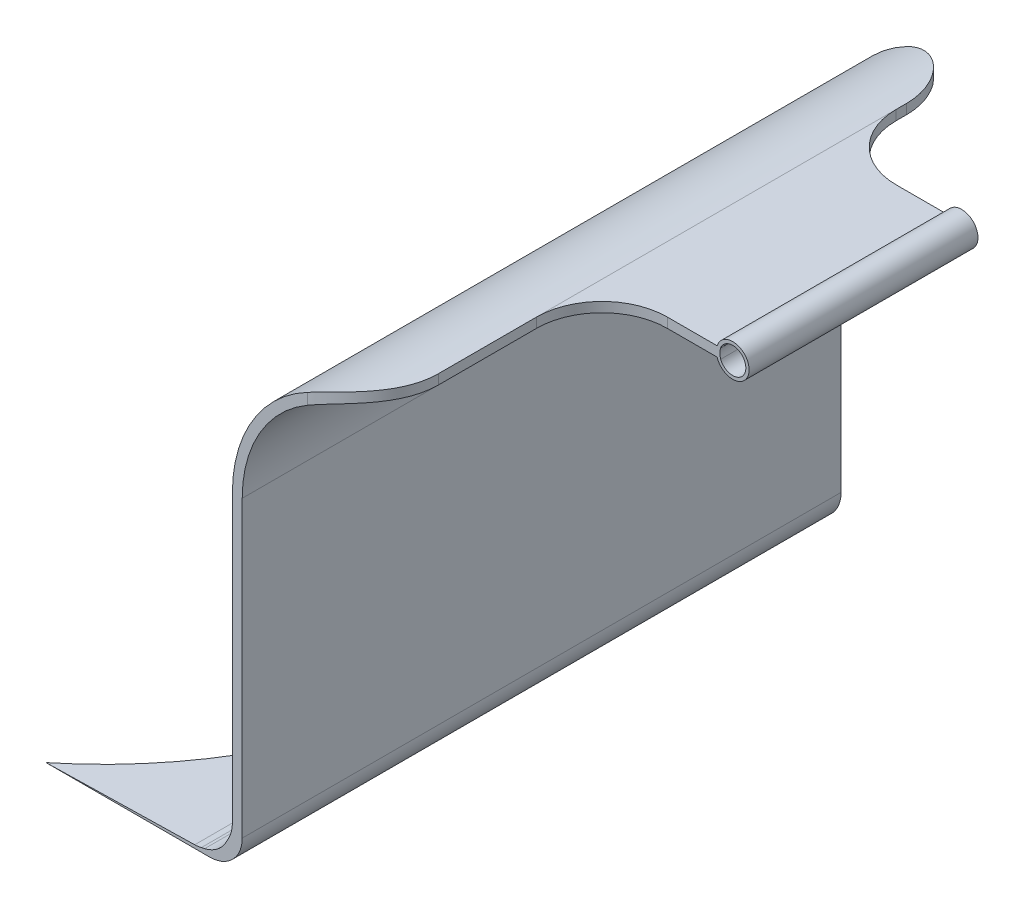
from build123d import *

# Parameters (mm, degrees)
BOSS_EXTRUDE2_DEPTH = 105
SKETCH2_W           = 40
SKETCH2_H           = 70
CUT_EXTRUDE1_DEPTH  = 105
FILLET1_R           = 20
FILLET2_R           = 20
SKETCH3_R           = 5
SKETCH3_R_2         = 4
BOSS_EXTRUDE3_DEPTH = 70
SKETCH4_R           = 3.960689981
CUT_EXTRUDE2_DEPTH  = 70
SKETCH5_W           = 109.66717185
SKETCH5_H           = 31.212047829
CUT_EXTRUDE3_DEPTH  = 226.995575224
FILLET3_R           = 20
CUT_EXTRUDE4_DEPTH  = 228.140735518


with BuildPart() as part:
    # Sketch1 → Boss-Extrude2 (new, symmetric)
    with BuildSketch(Plane.XY):
        with BuildLine():
            Line((0, 71.886792453), (-40, 71.886792453))
            ThreePointArc((-40, 71.886792453), (-68.284271247, 60.1710637), (-80, 31.886792453))
            Line((-80, 31.886792453), (-80, -58.113207547))
            ThreePointArc((-80, -58.113207547), (-82.928932188, -65.184275359), (-90, -68.113207547))
            Line((-90, -68.113207547), (-140, -68.113207547))
            Line((-140, -68.113207547), (-94.515046268, -67.122597845))
            ThreePointArc((-94.515046268, -67.122597845), (-93.499760174, -67.04866017), (-92.497251559, -66.871885994))
            Line((-92.497251559, -66.871885994), (-91.47680263, -66.637838075))
            ThreePointArc((-91.47680263, -66.637838075), (-87.662546027, -64.853336369), (-84.921098336, -61.656859506))
            Line((-84.921098336, -61.656859506), (-84.208764192, -60.34289018))
            ThreePointArc((-84.208764192, -60.34289018), (-83.306900442, -58.035369732), (-83, -55.576951347))
            Line((-83, -55.576951347), (-83, 31.886792453))
            ThreePointArc((-83, 31.886792453), (-70.405591591, 62.292384044), (-40, 74.886792453))
            Line((-40, 74.886792453), (0, 74.886792453))
            Line((0, 74.886792453), (0, 71.886792453))
        make_face()
    extrude(amount=BOSS_EXTRUDE2_DEPTH, both=True)

    # Sketch2 → Cut-Extrude1 (cut, symmetric)
    with BuildSketch(Plane(origin=(0, 74.886792453, 0), x_dir=(1, 0, 0), z_dir=(0, 1, 0))):
        with Locations((-20, 70)):
            Rectangle(SKETCH2_W, SKETCH2_H)
        with Locations((-20, -70)):
            Rectangle(SKETCH2_W, SKETCH2_H)
    extrude(amount=CUT_EXTRUDE1_DEPTH, both=True, mode=Mode.SUBTRACT)

    # Fillet1
    fillet1_edges = [part.edges().sort_by_distance(p)[0] for p in [
        (-40, 73.386792453, -35),
        (-40, 73.386792453, 35),
    ]]
    fillet(fillet1_edges, radius=FILLET1_R)

    # Fillet2
    # the kernel refuses this fillet: 20 mm, written as the material it takes off along each edge
    with BuildSketch(Plane(origin=(-40, 21.886792453, -105), x_dir=(-1, 0, 0), z_dir=(0, 1, 0)), Plane(origin=(-40, 124.886792453, 105), x_dir=(-1, 0, 0), z_dir=(0, -1, 0))) as fillet2_piece_1:
        with BuildLine():
            CenterArc((FILLET2_R, FILLET2_R), FILLET2_R, 180, 90)
            Line((0, FILLET2_R), (0, 0))
            Line((0, 0), (FILLET2_R, 0))
        make_face()
    extrude(amount=103, mode=Mode.SUBTRACT)

    # Sketch3 → Boss-Extrude3 (add)
    with BuildSketch(Plane.XY.offset(35)):
        with Locations((0, 73.386792453)):
            Circle(SKETCH3_R)
        with Locations((0, 73.386792453)):
            Circle(SKETCH3_R_2, mode=Mode.SUBTRACT)
    extrude(amount=-BOSS_EXTRUDE3_DEPTH)

    # Sketch4 → Cut-Extrude2 (cut)
    with BuildSketch(Plane.XY.offset(35)):
        with Locations((0, 73.386792453)):
            Circle(SKETCH4_R)
    extrude(amount=-CUT_EXTRUDE2_DEPTH, mode=Mode.SUBTRACT)

    # Sketch5 → Cut-Extrude3 (cut, through all)
    with BuildSketch(Plane(origin=(0, 74.886792453, 0), x_dir=(1, 0, 0), z_dir=(0, 1, 0))):
        with Locations((-94.833585925, 93.735031647)):
            Rectangle(SKETCH5_W, SKETCH5_H)
    extrude(amount=-CUT_EXTRUDE3_DEPTH, mode=Mode.SUBTRACT)

    # Fillet3
    # the kernel refuses this fillet: 20 mm, written as the material it takes off along each edge
    with BuildSketch(Plane(origin=(-40, 124.886792453, -78.129007732), x_dir=(-1, 0, 0), z_dir=(0, -1, 0))) as fillet3_piece_1:
        with BuildLine():
            CenterArc((FILLET3_R, -FILLET3_R), FILLET3_R, 90, 90)
            Line((0, -FILLET3_R), (0, 0))
            Line((0, 0), (FILLET3_R, 0))
        make_face()
    extrude(amount=103, mode=Mode.SUBTRACT)

    # Sketch6 → Cut-Extrude4 (cut, through all)
    with BuildSketch(Plane(origin=(1.416350581, -65.033322939, 0), x_dir=(0.9997629253149604, 0.021773680572498965, 0), z_dir=(-0.021773680572498965, 0.9997629253149604, 0))):
        with BuildLine():
            Line((-141.449884768, 78.129007732), (-141.449884768, -105))
            ThreePointArc((-141.449884768, -105), (-96.291711515, -13.435496134), (-141.449884768, 78.129007732))
        make_face()
    extrude(amount=-CUT_EXTRUDE4_DEPTH, mode=Mode.SUBTRACT)


solid = part.part
